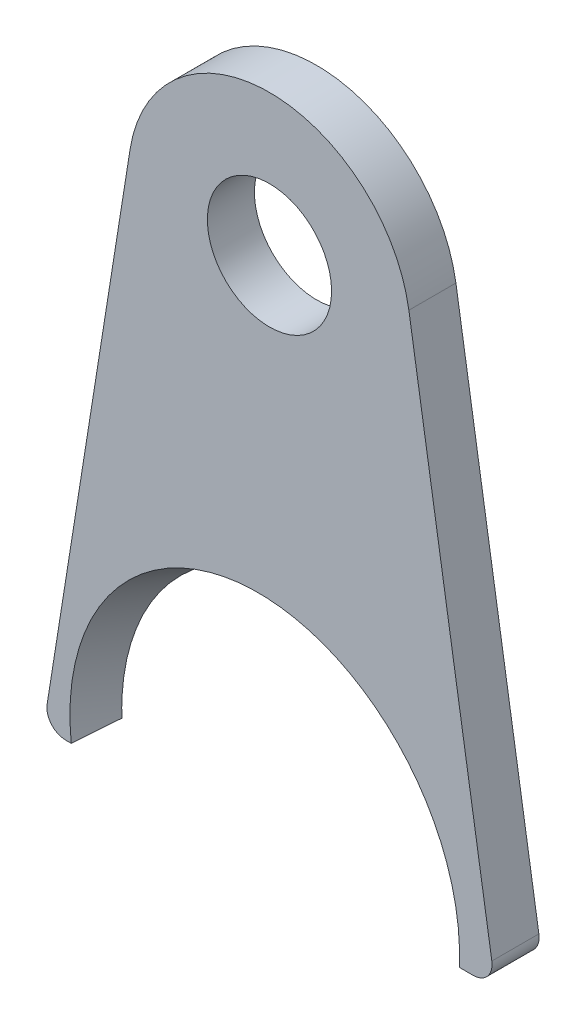
from build123d import *

# Parameters (mm, degrees)
SKETCH1_R           = 4.191
BOSS_EXTRUDE1_DEPTH = 3.175
CAVITY1_START       = 3.689049998
CAVITY1_DEPTH       = 9.603434939
FILLET3_R           = 1.27


# Read off the part's stored shape, not the designer's step: Cavity1
with BuildPart() as part:
    # Sketch1 → Boss-Extrude1 (new body)
    with BuildSketch(Plane.XY):
        with BuildLine():
            ThreePointArc((9.406966983, 1.494856913), (0, 9.525), (-9.406966983, 1.494856913))
            Line((-9.406966983, 1.494856913), (-15.24, -35.211766))
            Line((-15.24, -35.211766), (15.24, -35.211766))
            Line((15.24, -35.211766), (9.406966983, 1.494856913))
        make_face()
        Circle(SKETCH1_R, mode=Mode.SUBTRACT)
    extrude(amount=BOSS_EXTRUDE1_DEPTH)

    # Cavity1 outline → Cavity1 (cut)
    with BuildSketch(Plane(origin=(0, 0, 0), x_dir=(0.9955947349362284, 0.032256539947670526, 0.08803771576924041), z_dir=(0.09376099278090663, -0.3425138790307331, -0.9348225066311033)).offset(CAVITY1_START)):
        with BuildLine():
            Line((-14.012226084, 36), (-14.169183947, 34.154693399))
            ThreePointArc((-14.169183947, 34.154693399), (-1.135248211, 19.965054491), (11.898687525, 34.154693399))
            Line((11.898687525, 34.154693399), (11.741729662, 36))
            Line((11.741729662, 36), (-14.012226084, 36))
        make_face()
    extrude(amount=CAVITY1_DEPTH, mode=Mode.SUBTRACT)

    # Fillet3
    fillet3_edges = [part.edges().sort_by_distance(p)[0] for p in [
        (-15.24, -35.211766, 1.5875),
        (15.24, -35.211766, 1.5875),
    ]]
    fillet(fillet3_edges, radius=FILLET3_R)


solid = part.part
